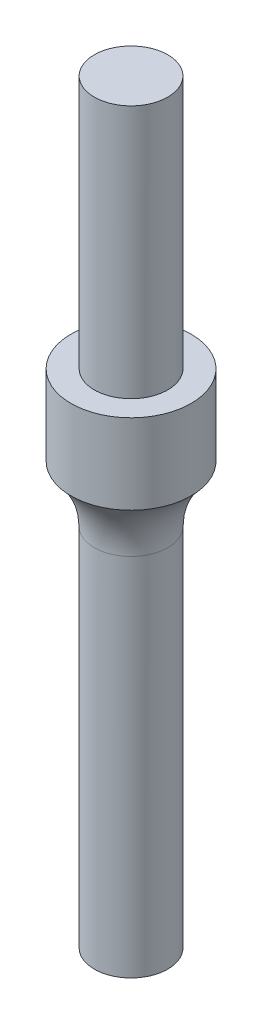
from build123d import *

# Parameters (mm, degrees)
FILLET_1_R      = 3
SKETCH_3_R      = 1.375
EXTRUDE_2_DEPTH = 2.5


with BuildPart() as part:
    # Эскиз1 → Повернуть1 (revolve)
    with BuildSketch(Plane(origin=(0, 0, -25.3000002), x_dir=(-1, 0, 0), z_dir=(0, 0, -1)), mode=Mode.PRIVATE) as revolve_1_sk:
        Polygon((-39.00000074, -6.09116098), (-39.00000074, 19.69999898), (-40.37500074, 19.69999898), (-40.37500074, 12.69999898), (-41.25000074, 12.69999898), (-41.25000074, 9.69999898), (-40.37500074, 9.69999898), (-40.37500074, -6.09116098), align=None)
    revolve(revolve_1_sk.sketch.rotate(Axis((39.00000074, -6.09116098, -25.3000002), (0, 1, 0)), 90), axis=Axis((39.00000074, -6.09116098, -25.3000002), (0, 1, 0)))

    # Скругление1
    # the kernel refuses this fillet: 3 mm, written as the material it adds along each edge
    with BuildSketch(Plane(origin=(39.00000074, 9.69999898, -25.3000002), x_dir=(0, 0, -1), z_dir=(1, 0, 0))) as fillet_1_piece_1:
        with BuildLine():
            CenterArc((4.375, -2.117634293), FILLET_1_R, 135.099472039, 44.900527961)
            Line((1.375, -2.117634293), (1.315, -2.117634293))
            Line((1.315, -2.117634293), (1.315, 0))
            Line((1.315, 0), (1.375, 0.06))
            ThreePointArc((1.375, 0.06), (1.8125, 0.06), (2.2075, 0.042352686))
            Line((2.2075, 0.042352686), (2.25, 0))
        make_face()
    revolve(axis=Axis((39.00000074, 9.69999898, -25.3000002), (0, 1, 0)))

    # Эскиз3 → Бобышка-Вытянуть2 (add)
    with BuildSketch(Plane(origin=(0, 19.69999898, 0), x_dir=(1, 0, 0), z_dir=(0, 1, 0))):
        with Locations(Location((39.00000074, 25.3000002, 0), (0, 0, 90))):
            Circle(SKETCH_3_R)
    extrude(amount=EXTRUDE_2_DEPTH)


solid = part.part
